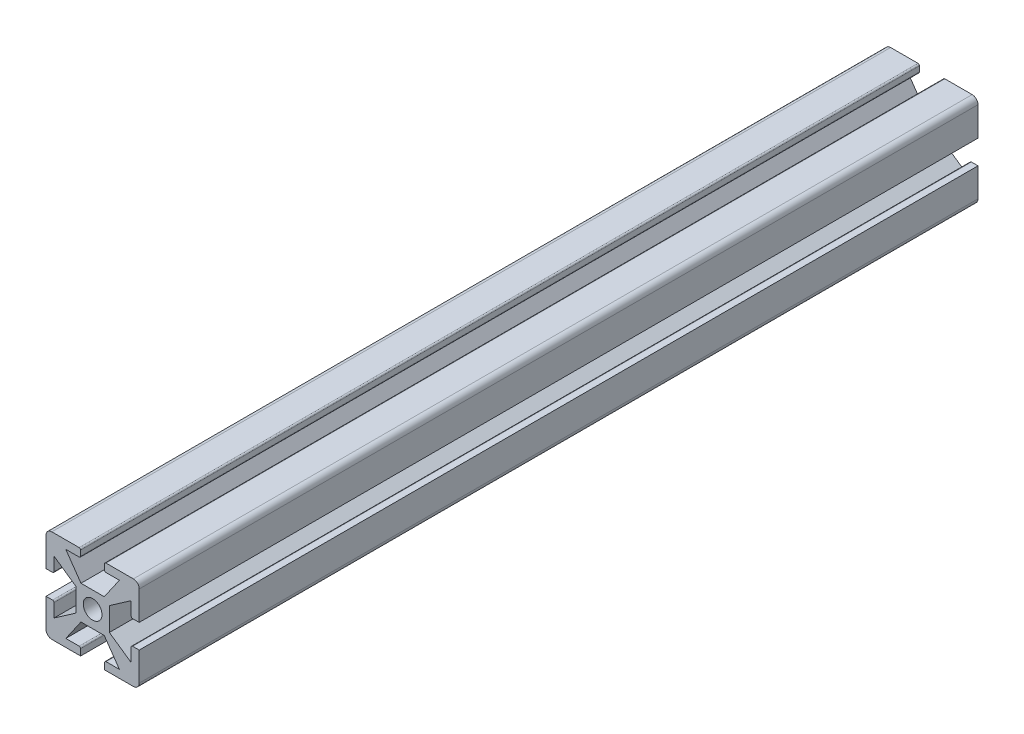
from build123d import *

# Parameters (mm, degrees)
SKETCH1_W           = 25.4
SKETCH1_H           = 25.4
BOSS_EXTRUDE1_DEPTH = 228.6
FILLET1_R           = 1.5875
HOLE1_OUTLINE_R     = 2.5527
HOLE1_DEPTH         = 228.6
SKETCH7_W           = 6.5278
SKETCH7_H           = 2.2352
CUT_EXTRUDE2_DEPTH  = 228.6
FILLET4_R           = 0.396875
CIRPATTERN2_DEPTH   = 228.6


# Read off the part's stored shape, not the designer's step: Hole1, CirPattern2
with BuildPart() as part:
    # Sketch1 → Boss-Extrude1 (new body)
    with BuildSketch(Plane.XY):
        Rectangle(SKETCH1_W, SKETCH1_H)
    extrude(amount=BOSS_EXTRUDE1_DEPTH)

    # Fillet1
    fillet1_edges = [part.edges().sort_by_distance(p)[0] for p in [
        (12.7, -12.7, 114.3),
        (-12.7, -12.7, 114.3),
        (-12.7, 12.7, 114.3),
        (12.7, 12.7, 114.3),
    ]]
    fillet(fillet1_edges, radius=FILLET1_R)

    # Hole1 outline → Hole1 (cut)
    with BuildSketch(Plane.XY):
        with Locations((0, -0.048792482)):
            Circle(HOLE1_OUTLINE_R)
    extrude(amount=HOLE1_DEPTH, mode=Mode.SUBTRACT)

    # Sketch7 → Cut-Extrude2 (cut)
    with BuildSketch(Plane.XY.offset(228.6)):
        with Locations((0, 11.5824)):
            Rectangle(SKETCH7_W, SKETCH7_H)
        Polygon((-3.175, 4.5212), (-7.3025, 10.4648), (7.3025, 10.4648), (3.175, 4.5212), align=None)
    extrude(amount=-CUT_EXTRUDE2_DEPTH, mode=Mode.SUBTRACT)

    # Fillet4
    fillet4_edges = [part.edges().sort_by_distance(p)[0] for p in [
        (-3.2639, 10.4648, 114.3),
        (-3.2639, 12.7, 114.3),
        (3.2639, 12.7, 114.3),
        (3.2639, 10.4648, 114.3),
    ]]
    fillet(fillet4_edges, radius=FILLET4_R)

    # CirPattern2 outline → CirPattern2 (cut)
    with BuildSketch(Plane.XY):
        with BuildLine():
            ThreePointArc((-3.660775, -10.562384964), (-3.380141996, -10.67862696), (-3.2639, -10.959259964))
            Line((-3.2639, -10.959259964), (-3.2639, -12.7))
            Line((-3.2639, -12.7), (3.2639, -12.7))
            Line((3.2639, -12.7), (3.2639, -10.959259964))
            ThreePointArc((3.2639, -10.959259964), (3.380141996, -10.67862696), (3.660775, -10.562384964))
            Line((3.660775, -10.562384964), (7.3025, -10.562384964))
            Line((7.3025, -10.562384964), (3.175, -4.618784964))
            Line((3.175, -4.618784964), (-3.175, -4.618784964))
            Line((-3.175, -4.618784964), (-7.3025, -10.562384964))
            Line((-7.3025, -10.562384964), (-3.660775, -10.562384964))
        make_face()
        with BuildLine():
            Line((-12.7, -3.312692482), (-10.910467482, -3.312692482))
            ThreePointArc((-10.910467482, -3.312692482), (-10.629834478, -3.428934478), (-10.513592482, -3.709567482))
            Line((-10.513592482, -3.709567482), (-10.513592482, -7.351292482))
            Line((-10.513592482, -7.351292482), (-4.569992482, -3.223792482))
            Line((-4.569992482, -3.223792482), (-4.569992482, 3.126207518))
            Line((-4.569992482, 3.126207518), (-10.513592482, 7.253707518))
            Line((-10.513592482, 7.253707518), (-10.513592482, 3.611982518))
            ThreePointArc((-10.513592482, 3.611982518), (-10.629834478, 3.331349514), (-10.910467482, 3.215107518))
            Line((-10.910467482, 3.215107518), (-12.7, 3.215107518))
            Line((-12.7, 3.215107518), (-12.7, -3.312692482))
        make_face()
        with BuildLine():
            ThreePointArc((10.513592482, -3.709567482), (10.629834478, -3.428934478), (10.910467482, -3.312692482))
            Line((10.910467482, -3.312692482), (12.7, -3.312692482))
            Line((12.7, -3.312692482), (12.7, 3.215107518))
            Line((12.7, 3.215107518), (10.910467482, 3.215107518))
            ThreePointArc((10.910467482, 3.215107518), (10.629834478, 3.331349514), (10.513592482, 3.611982518))
            Line((10.513592482, 3.611982518), (10.513592482, 7.253707518))
            Line((10.513592482, 7.253707518), (4.569992482, 3.126207518))
            Line((4.569992482, 3.126207518), (4.569992482, -3.223792482))
            Line((4.569992482, -3.223792482), (10.513592482, -7.351292482))
            Line((10.513592482, -7.351292482), (10.513592482, -3.709567482))
        make_face()
    extrude(amount=CIRPATTERN2_DEPTH, mode=Mode.SUBTRACT)


solid = part.part
